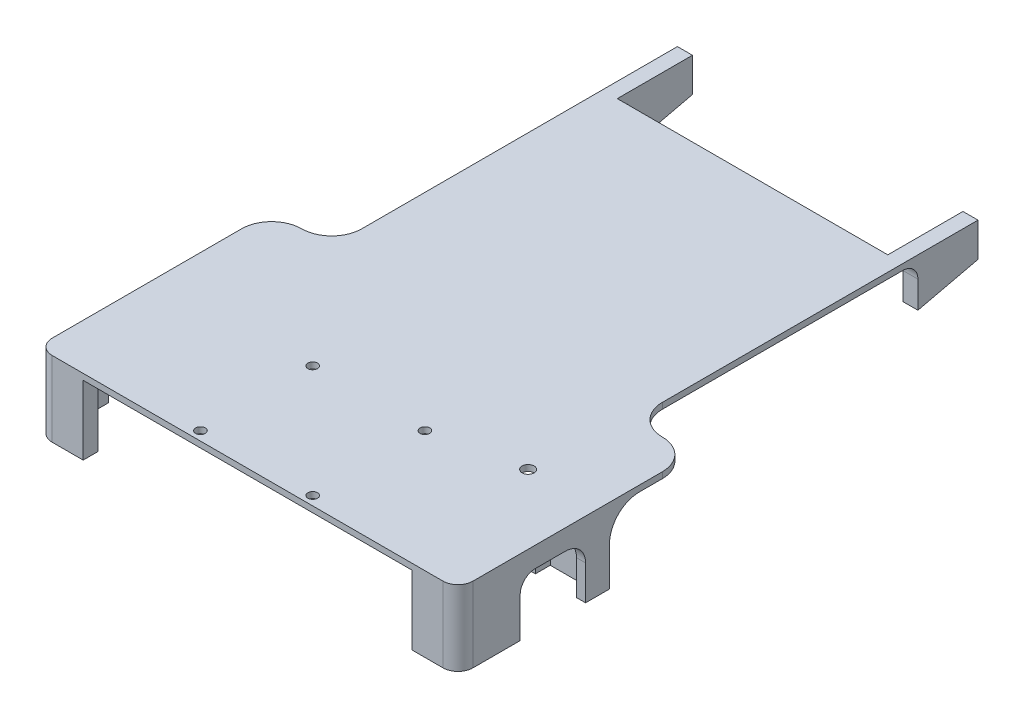
from build123d import *

# Parameters (mm, degrees)
SKETCH_1_W             = 140
SKETCH_1_H             = 193
EXTRUDE_1_DEPTH        = 2
SKETCH_2_R             = 1.6
CUT_EXTRUDE_1_DEPTH    = 120.231916868
EXTRUDE_2_DEPTH        = 23
CUT_EXTRUDE_2_DEPTH    = 172.584527274
FILLET_1_R             = 5
FILLET_2_R             = 10
SKETCH_5_R             = 2
CUT_EXTRUDE_3_DEPTH    = 122.808250952
FILLET_3_R             = 5
SKETCH_6_W             = 20
SKETCH_6_H             = 115
CUT_EXTRUDE_4_DEPTH    = 122.808250952
FILLET_START           = -23
FILLET_4_DEPTH         = 26
FILLET_4_2_DEPTH       = 2
SKETCH_7_W             = 90
SKETCH_7_H             = 25
CUT_EXTRUDE_5_DEPTH    = 122.413549491
EXTRUDE_5_DEPTH        = 5
FILLET_8_R             = 5
FILLET_8_OF_MIRROR_3_R = 5


with BuildPart() as part:
    # 스케치1 → 보스-돌출1 (new body)
    with BuildSketch(Plane(origin=(0, 0, 0), x_dir=(1, 0, 0), z_dir=(0, 1, 0))):
        Rectangle(SKETCH_1_W, SKETCH_1_H)
    extrude(amount=EXTRUDE_1_DEPTH)

    # 스케치2 → 컷-돌출1 (cut, through all)
    with BuildSketch(Plane(origin=(0, 2, 0), x_dir=(1, 0, 0), z_dir=(0, 1, 0))):
        with Locations(Location((-18.67, -93.5, 0), (0, 0, 270))):
            Circle(SKETCH_2_R)
        with Locations(Location((18.67, -93.5, 0), (0, 0, 270))):
            Circle(SKETCH_2_R)
        with Locations(Location((18.67, -56.16, 0), (0, 0, 270))):
            Circle(SKETCH_2_R)
        with Locations(Location((-18.67, -56.16, 0), (0, 0, 270))):
            Circle(SKETCH_2_R)
    extrude(amount=-CUT_EXTRUDE_1_DEPTH, mode=Mode.SUBTRACT)

    # 스케치3 → 보스-돌출2 (add)
    with BuildSketch(Plane(origin=(0, 0, 0), x_dir=(-1, 0, 0), z_dir=(0, -1, 0))):
        Polygon((70, -96.5), (70, -46.1), (50.3, -46.1), (50.3, -56.1), (53.3, -56.1), (53.3, -49.1), (67, -49.1), (67, -91.5), (54.7, -91.5), (54.7, -96.5), align=None)
    extrude_2 = extrude(amount=EXTRUDE_2_DEPTH)

    # 대칭 복사1: 보스-돌출2 across plane
    add(extrude_2.mirror(Plane(origin=(0, 0, 0), x_dir=(0, 0, 1), z_dir=(1, 0, 0))))

    # 스케치4 → 컷-돌출2 (cut, through all)
    with BuildSketch(Plane.ZY.offset(70)):
        with BuildLine():
            Line((54.05, -11.5), (54.05, -23))
            Line((54.05, -23), (75.8, -23))
            Line((75.8, -23), (75.8, -4.75))
            Line((75.8, -4.75), (60.8, -4.75))
            ThreePointArc((60.8, -4.75), (56.027029227, -6.727029227), (54.05, -11.5))
        make_face()
    extrude(amount=-CUT_EXTRUDE_2_DEPTH, mode=Mode.SUBTRACT)

    # 필렛1
    fillet_1_edges = [part.edges().sort_by_distance(p)[0] for p in [
        (-68.5, -4.75, 75.8),
        (68.5, -4.75, 75.8),
    ]]
    fillet(fillet_1_edges, radius=FILLET_1_R)

    # 필렛2
    fillet_2_edges = [part.edges().sort_by_distance(p)[0] for p in [
        (-60.15, 0, 46.1),
        (60.15, 0, 46.1),
    ]]
    fillet(fillet_2_edges, radius=FILLET_2_R)

    # 스케치5 → 컷-돌출3 (cut, through all)
    with BuildSketch(Plane(origin=(0, 2, 0), x_dir=(1, 0, 0), z_dir=(0, 1, 0))):
        with Locations(Location((47, -50.16, 0), (0, 0, 270))):
            Circle(SKETCH_5_R)
    extrude(amount=-CUT_EXTRUDE_3_DEPTH, mode=Mode.SUBTRACT)

    # 필렛3
    fillet_3_edges = [part.edges().sort_by_distance(p)[0] for p in [
        (70, -10.5, 96.5),
        (-70, -10.5, 96.5),
    ]]
    fillet(fillet_3_edges, radius=FILLET_3_R)

    # 스케치6 → 컷-돌출4 (cut, through all)
    with BuildSketch(Plane(origin=(0, 2, 0), x_dir=(1, 0, 0), z_dir=(0, 1, 0))):
        with Locations((-60, 39)):
            Rectangle(SKETCH_6_W, SKETCH_6_H)
        with Locations((60, 39)):
            Rectangle(SKETCH_6_W, SKETCH_6_H)
    extrude(amount=-CUT_EXTRUDE_4_DEPTH, mode=Mode.SUBTRACT)

    # 필렛4: read off the stored shape, not the designer's step
    # 필렛4 outline → 필렛4 (cut)
    with BuildSketch(Plane(origin=(0, 0, 0), x_dir=(1, 0, 0), z_dir=(0, 1, 0)).offset(FILLET_START)):
        with BuildLine():
            Line((70, -18.5), (60, -18.5))
            ThreePointArc((60, -18.5), (67.071067812, -21.428932188), (70, -28.5))
            Line((70, -28.5), (70, -18.5))
        make_face()
        with BuildLine():
            ThreePointArc((-70, -28.5), (-67.071067812, -21.428932188), (-60, -18.5))
            Line((-60, -18.5), (-70, -18.5))
            Line((-70, -18.5), (-70, -28.5))
        make_face()
    extrude(amount=FILLET_4_DEPTH, mode=Mode.SUBTRACT)

    # Fillet 4 2 outline → Fillet 4 2 (add)
    with BuildSketch(Plane(origin=(0, 0, 0), x_dir=(1, 0, 0), z_dir=(0, 1, 0))):
        with BuildLine():
            Line((50, -18.5), (60, -18.5))
            ThreePointArc((60, -18.5), (52.928932188, -15.571067812), (50, -8.5))
            Line((50, -8.5), (50, -18.5))
        make_face()
        with BuildLine():
            ThreePointArc((-50, -8.5), (-52.928932188, -15.571067812), (-60, -18.5))
            Line((-60, -18.5), (-50, -18.5))
            Line((-50, -18.5), (-50, -8.5))
        make_face()
    extrude(amount=FILLET_4_2_DEPTH)

    # 스케치7 → 컷-돌출5 (cut, through all)
    with BuildSketch(Plane.XZ):
        with Locations((0, -84)):
            Rectangle(SKETCH_7_W, SKETCH_7_H)
    extrude(amount=-CUT_EXTRUDE_5_DEPTH, mode=Mode.SUBTRACT)

    # 스케치11 → 보스-돌출5 (add)
    with BuildSketch(Plane.ZY.offset(50)):
        Polygon((-96.5, 0), (-96.5, -9.324233381), (-76.5, -13.973838302), (-76.5, 0), align=None)
    extrude_5 = extrude(amount=-EXTRUDE_5_DEPTH)

    # 필렛8
    fillet_8_edges = [part.edges().sort_by_distance(p)[0] for p in [
        (-47.5, 0, -76.5),
    ]]
    fillet(fillet_8_edges, radius=FILLET_8_R)

    # 대칭 복사3: 보스-돌출5 across plane
    add(extrude_5.mirror(Plane(origin=(0, 0, 0), x_dir=(0, 0, 1), z_dir=(1, 0, 0))))

    # 필렛8 of 대칭 복사3
    fillet_8_of_mirror_3_edges = [part.edges().sort_by_distance(p)[0] for p in [
        (47.5, 0, -76.5),
    ]]
    fillet(fillet_8_of_mirror_3_edges, radius=FILLET_8_OF_MIRROR_3_R)


solid = part.part
